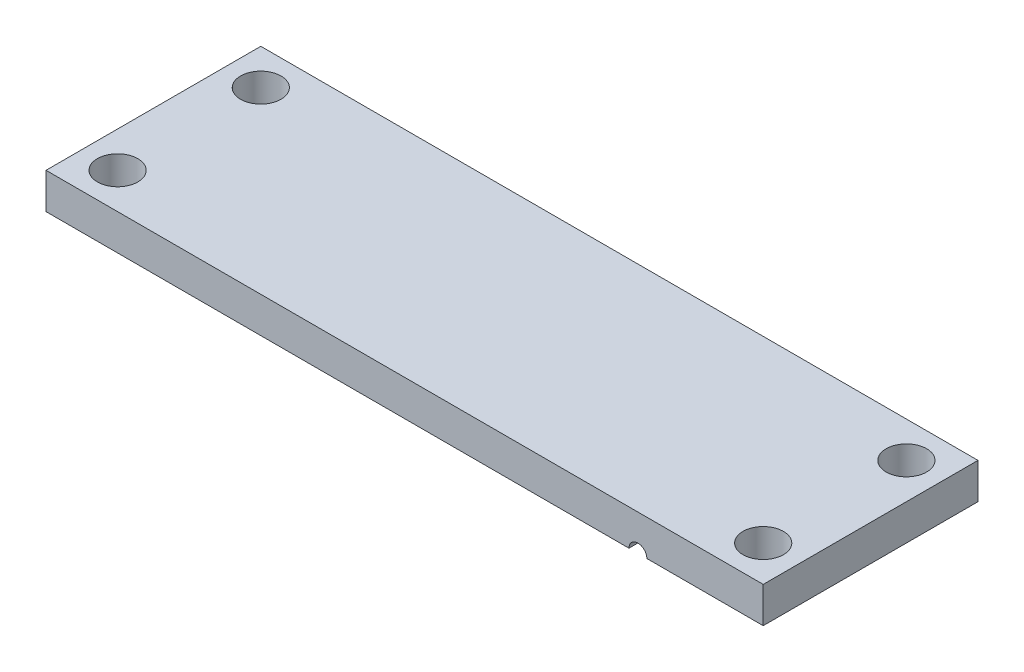
from build123d import *

# Parameters (mm, degrees)
SKETCH1_W           = 40.07
SKETCH1_H           = 12
SKETCH1_R           = 1.1303
BOSS_EXTRUDE1_DEPTH = 2
SKETCH3_R           = 0.5


with BuildPart() as part:
    # Sketch1 → Boss-Extrude1 (new body)
    with BuildSketch(Plane(origin=(0, 0, 0), x_dir=(1, 0, 0), z_dir=(0, 1, 0))):
        with Locations((20.035, -6)):
            Rectangle(SKETCH1_W, SKETCH1_H)
        with Locations((38.07, -2)):
            Circle(SKETCH1_R, mode=Mode.SUBTRACT)
        with Locations((38.07, -10)):
            Circle(SKETCH1_R, mode=Mode.SUBTRACT)
        with Locations((2, -10)):
            Circle(SKETCH1_R, mode=Mode.SUBTRACT)
        with Locations((2, -2)):
            Circle(SKETCH1_R, mode=Mode.SUBTRACT)
    extrude(amount=BOSS_EXTRUDE1_DEPTH)

    # Cut-Sweep5: sweep along a path in Sketch2
    with BuildLine(Plane(origin=(0, 0, 0), x_dir=(1, 0, 0), z_dir=(0, 1, 0))) as cut_sweep5_path:
        Line((7, 0), (7, -8.4))
        ThreePointArc((7, -8.4), (8, -9.4), (9, -8.4))
        Line((9, -8.4), (9, -4.9))
        ThreePointArc((9, -4.9), (10, -3.9), (11, -4.9))
        Line((11, -4.9), (11, -8.4))
        ThreePointArc((11, -8.4), (12, -9.4), (13, -8.4))
        Line((13, -8.4), (13, -4.9))
        ThreePointArc((13, -4.9), (13.134234001, -4.399550966), (13.500898472, -4.033456484))
        Line((13.500898472, -4.033456484), (18.535898472, -1.133456484))
        ThreePointArc((18.535898472, -1.133456484), (19.535449034, -1.134234001), (20.035, -2))
        Line((20.035, -2), (20.035, -6))
        Line((20.035, -6), (20.035, -10))
        ThreePointArc((20.035, -10), (20.534550966, -10.865765999), (21.534101528, -10.866543516))
        Line((21.534101528, -10.866543516), (26.569101528, -7.966543516))
        ThreePointArc((26.569101528, -7.966543516), (26.935765999, -7.600449034), (27.07, -7.1))
        Line((27.07, -7.1), (27.07, -3.6))
        ThreePointArc((27.07, -3.6), (28.07, -2.6), (29.07, -3.6))
        Line((29.07, -3.6), (29.07, -7.1))
        ThreePointArc((29.07, -7.1), (30.07, -8.1), (31.07, -7.1))
        Line((31.07, -7.1), (31.07, -3.6))
        ThreePointArc((31.07, -3.6), (32.07, -2.6), (33.07, -3.6))
        Line((33.07, -3.6), (33.07, -12))
    # Sketch3 → Cut-Sweep5 (sweep, cut)
    with BuildSketch(Plane(origin=(0, 0, 0), x_dir=(-1, 0, 0), z_dir=(0, 0, -1))):
        with Locations((-7, 0)):
            Circle(SKETCH3_R)
    sweep(path=cut_sweep5_path.line, mode=Mode.SUBTRACT)


solid = part.part
